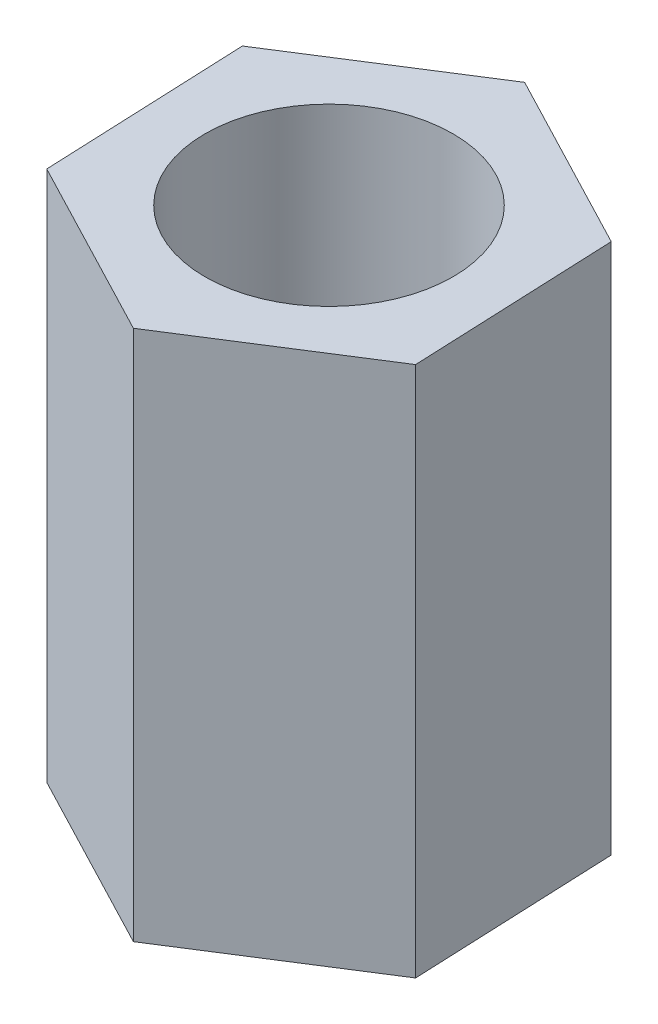
from build123d import *

# Parameters (mm, degrees)
SKETCH_1_R          = 2.1
EXTRUDE_1_DEPTH     = 60
SKETCH_2_R          = 2.1
EXTRUDE_2_DEPTH     = 40
CUT_EXTRUDE_1_DEPTH = 95
SKETCH_4_R          = 2.1
EXTRUDE_3_DEPTH     = 4


with BuildPart() as part:
    # 草图1 → 凸台-拉伸1 (new body)
    with BuildSketch(Plane(origin=(0, 0, 0), x_dir=(1, 0, 0), z_dir=(0, 1, 0))):
        Polygon((3.070700034, -1.603371853), (2.923910774, 1.85761831), (-0.14678926, 3.460990164), (-3.070700034, 1.603371853), (-2.923910774, -1.85761831), (0.14678926, -3.460990164), align=None)
        Circle(SKETCH_1_R, mode=Mode.SUBTRACT)
    extrude(amount=EXTRUDE_1_DEPTH)

    # 草图2 → 凸台-拉伸2 (add)
    with BuildSketch(Plane(origin=(0, 60, 0), x_dir=(1, 0, 0), z_dir=(0, 1, 0))):
        Polygon((-2.923910774, -1.85761831), (0.14678926, -3.460990164), (3.070700034, -1.603371853), (2.923910774, 1.85761831), (-0.14678926, 3.460990164), (-3.070700034, 1.603371853), align=None)
        Circle(SKETCH_2_R, mode=Mode.SUBTRACT)
    extrude(amount=EXTRUDE_2_DEPTH)

    # 草图3 → 切除-拉伸1 (cut)
    with BuildSketch(Plane(origin=(0, 100, 0), x_dir=(1, 0, 0), z_dir=(0, 1, 0))):
        Polygon((-2.923910774, -1.85761831), (0.14678926, -3.460990164), (3.070700034, -1.603371853), (2.923910774, 1.85761831), (-0.14678926, 3.460990164), (-3.070700034, 1.603371853), align=None)
    extrude(amount=-CUT_EXTRUDE_1_DEPTH, mode=Mode.SUBTRACT)

    # 草图4 → 凸台-拉伸3 (add)
    with BuildSketch(Plane(origin=(0, 5, 0), x_dir=(1, 0, 0), z_dir=(0, 1, 0))):
        Polygon((-0.14678926, 3.460990164), (-3.070700034, 1.603371853), (-2.923910774, -1.85761831), (0.14678926, -3.460990164), (3.070700034, -1.603371853), (2.923910774, 1.85761831), align=None)
        Circle(SKETCH_4_R, mode=Mode.SUBTRACT)
    extrude(amount=EXTRUDE_3_DEPTH)


solid = part.part
